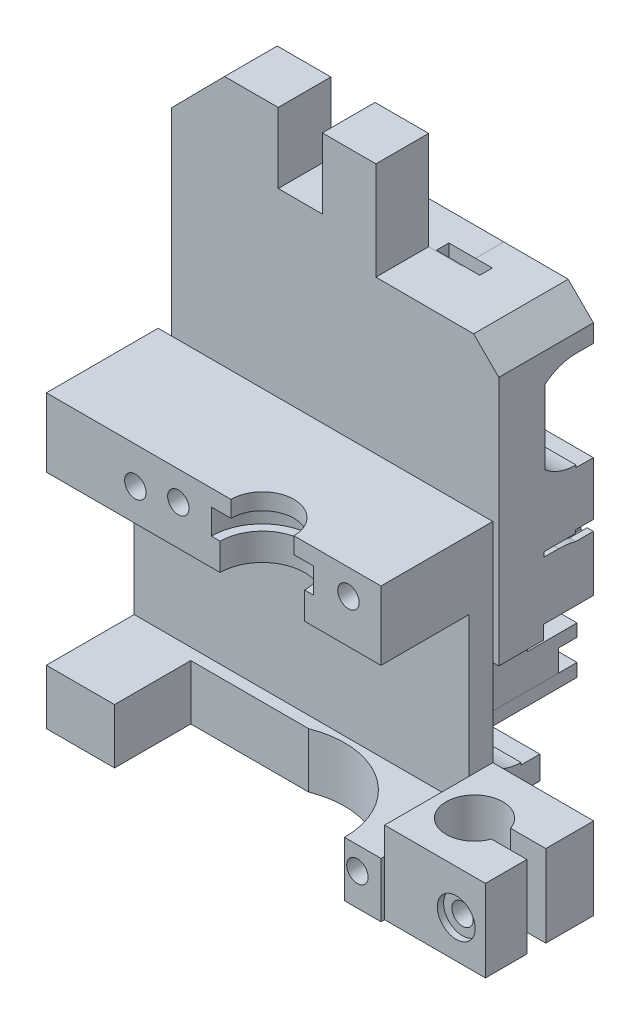
from build123d import *
from OCP.BRepAlgoAPI import BRepAlgoAPI_Cut
from OCP.TopTools import TopTools_ListOfShape

# Parameters (mm, degrees)
SKETCH1_W                     = 45
SKETCH1_H                     = 45
BOSS_EXTRUDE1_DEPTH           = 35
SKETCH2_R                     = 13
CUT_EXTRUDE3_DEPTH            = 35
SKETCH4_R                     = 1.7
CUT_EXTRUDE8_DEPTH            = 35
SKETCH7_R                     = 1.7
CUT_EXTRUDE9_DEPTH            = 35
SKETCH6_R                     = 1.7
CUT_EXTRUDE10_DEPTH           = 35
SKETCH5_R                     = 1.7
CUT_EXTRUDE11_DEPTH           = 35
CUT_EXTRUDE12_DEPTH           = 12
BOSS_EXTRUDE4_DEPTH           = 2
BOSS_EXTRUDE4_DEPTH_BACK      = 37.5
SKETCH14_W                    = 6
SKETCH14_H                    = 6
CUT_EXTRUDE17_START           = -7
SKETCH20_R                    = 2.2
CUT_EXTRUDE17_DEPTH           = 70.77141069
SKETCH21_R                    = 1.75
CUT_EXTRUDE18_DEPTH           = 2
BOSS_EXTRUDE5_DEPTH           = 44.571207257
BOSS_EXTRUDE5_DEPTH_BACK      = 1.562633388
SKETCH22_W                    = 53.082637552
SKETCH22_H                    = 40.002520942
SKETCH23_W                    = 29.449729346
SKETCH23_H                    = 26.517519529
CUT_EXTRUDE19_DEPTH           = 95.427299018
SKETCH25_R                    = 5
CUT_EXTRUDE24_DEPTH           = 2.6
SKETCH26_R                    = 8.1
CUT_EXTRUDE25_DEPTH           = 4
SKETCH27_R                    = 6.7
CUT_EXTRUDE28_DEPTH           = 6
SKETCH30_R                    = 13
CUT_EXTRUDE30_DEPTH           = 10.767560088
SKETCH31_W                    = 19.349450051
SKETCH31_H                    = 23.644133728
CUT_EXTRUDE31_DEPTH           = 9.664293754
SKETCH34_R                    = 1.5
CUT_EXTRUDE32_DEPTH           = 9
SKETCH37_W                    = 11.635024897
SKETCH37_H                    = 10.599921236
BOSS_EXTRUDE6_DEPTH           = 10
BOSS_EXTRUDE6_OTHER_WAY_DEPTH = 5
BOSS_EXTRUDE6_OTHER_WAY_TAPER = 29
SKETCH38_R                    = 1.700000001
CUT_EXTRUDE33_DEPTH           = 10
SKETCH39_R                    = 1.700000001
CUT_EXTRUDE34_DEPTH           = 88.0662855
SKETCH40_W                    = 17.159872711
SKETCH40_H                    = 13
BOSS_EXTRUDE7_DEPTH           = 16
SKETCH41_R                    = 4.5
CUT_EXTRUDE35_DEPTH           = 15
SKETCH42_W                    = 9.331425876
SKETCH42_H                    = 3
CUT_EXTRUDE36_DEPTH           = 15
CUT_EXTRUDE37_DEPTH           = 5
SKETCH44_R                    = 1.7
CUT_EXTRUDE38_DEPTH           = 23
CUT_EXTRUDE39_DEPTH           = 5
CUT_EXTRUDE40_DEPTH           = 5
CUT_EXTRUDE41_DEPTH           = 5
SKETCH53_R                    = 1.7
CUT_EXTRUDE42_DEPTH           = 90.646740997
SKETCH52_R                    = 1.7
CUT_EXTRUDE43_DEPTH           = 90.646740997
SKETCH51_R                    = 1.7
CUT_EXTRUDE44_DEPTH           = 90.646740997
CUT_EXTRUDE46_DEPTH           = 5
SKETCH57_R                    = 3
CUT_EXTRUDE48_DEPTH           = 2.5
SKETCH58_R                    = 3
CUT_EXTRUDE49_DEPTH           = 2.5
SKETCH59_R                    = 3
CUT_EXTRUDE50_DEPTH           = 2.5
SKETCH60_R                    = 3
CUT_EXTRUDE51_DEPTH           = 1
SKETCH61_W                    = 6.542017971
SKETCH61_H                    = 14.030300317
CUT_EXTRUDE52_DEPTH           = 6.5
SKETCH67_W                    = 5.604230097
SKETCH67_H                    = 8.996545788
BOSS_EXTRUDE8_DEPTH           = 33
SKETCH68_W                    = 5.604230097
SKETCH68_H                    = 9.400155495
BOSS_EXTRUDE9_DEPTH           = 33
SKETCH63_R                    = 1.7
CUT_EXTRUDE55_DEPTH           = 102.92049818
SKETCH62_R                    = 1.7
CUT_EXTRUDE56_DEPTH           = 102.92049818
SKETCH69_R                    = 3
CUT_EXTRUDE57_DEPTH           = 2.5
CUT_EXTRUDE58_DEPTH           = 2.5
SKETCH71_R                    = 3
CUT_EXTRUDE59_DEPTH           = 1
SKETCH73_R                    = 1.5
CUT_EXTRUDE61_DEPTH           = 5
SKETCH79_W                    = 95.658931194
SKETCH79_H                    = 51.290788201
CUT_EXTRUDE62_DEPTH           = 59
SKETCH80_W                    = 53.082637552
SKETCH80_H                    = 13.031868173
BOSS_EXTRUDE10_DEPTH          = 58
FILLET1_R                     = 5
SKETCH84_R                    = 17
CUT_EXTRUDE63_DEPTH           = 22
SKETCH85_R                    = 1.5
CUT_EXTRUDE64_DEPTH           = 15
SKETCH86_W                    = 15
SKETCH86_H                    = 8
BOSS_EXTRUDE11_DEPTH          = 7.5
BOSS_EXTRUDE12_START          = -29
BOSS_EXTRUDE12_DEPTH          = 15.917362448
BOSS_EXTRUDE12_START_2        = 15
BOSS_EXTRUDE12_2_OUTLINE_W    = 7.5
BOSS_EXTRUDE12_2_OUTLINE_H    = 8
BOSS_EXTRUDE12_2_DEPTH        = 10
BOSS_EXTRUDE13_DEPTH          = 15
BOSS_EXTRUDE13_START          = 15
BOSS_EXTRUDE13_2_DEPTH        = 10
SKETCH93_R                    = 7.627151398
CUT_EXTRUDE66_DEPTH           = 49.5
CUT_EXTRUDE67_DEPTH           = 53.5
SKETCH95_R                    = 7.676402713
CUT_EXTRUDE68_DEPTH           = 25.2
CUT_EXTRUDE69_DEPTH           = 34.5
CUT_EXTRUDE70_DEPTH           = 97.513539563
CUT_EXTRUDE70_DEPTH_BACK      = 97.513539563
SKETCH98_W                    = 8.013106882
SKETCH98_H                    = 5.054927498
SKETCH99_W                    = 2.898184018
SKETCH99_H                    = 3.4444183
CUT_EXTRUDE71_DEPTH           = 49.5
CUT_EXTRUDE75_DEPTH           = 2.8
CUT_EXTRUDE76_DEPTH           = 7.8
CUT_EXTRUDE77_START           = -2.8
CUT_EXTRUDE77_DEPTH           = 3.8
CUT_EXTRUDE77_START_2         = 24.96280414
CUT_EXTRUDE77_2_DEPTH         = 2.03719586
CUT_EXTRUDE78_DEPTH           = 7.8
SKETCH109_W                   = 3.474802874
SKETCH109_H                   = 1.768914447
SKETCH116_W                   = 11.383905976
SKETCH116_H                   = 17.385394655
CUT_EXTRUDE80_DEPTH           = 64
CUT_EXTRUDE81_DEPTH           = 1
SKETCH118_W                   = 155.245855906
SKETCH118_H                   = 137.927622152
CUT_EXTRUDE82_DEPTH           = 47


with BuildPart() as part:
    # Sketch1 → Boss-Extrude1 (new body)
    with BuildSketch(Plane.XY):
        Rectangle(SKETCH1_W, SKETCH1_H)
    extrude(amount=BOSS_EXTRUDE1_DEPTH)

    # Sketch2 → Cut-Extrude3 (cut)
    with BuildSketch(Plane.XY.offset(35)):
        Circle(SKETCH2_R)
    extrude(amount=-CUT_EXTRUDE3_DEPTH, mode=Mode.SUBTRACT)

    # Sketch4 → Cut-Extrude8 (cut)
    with BuildSketch(Plane(origin=(0, 0, 0), x_dir=(-1, 0, 0), z_dir=(0, 0, -1))):
        with Locations((-15.808862622, 15.928817575)):
            Circle(SKETCH4_R)
    extrude(amount=-CUT_EXTRUDE8_DEPTH, mode=Mode.SUBTRACT)

    # Sketch7 → Cut-Extrude9 (cut)
    with BuildSketch(Plane(origin=(0, 0, 0), x_dir=(-1, 0, 0), z_dir=(0, 0, -1))):
        with Locations((15.199970606, 15.923392722)):
            Circle(SKETCH7_R)
    extrude(amount=-CUT_EXTRUDE9_DEPTH, mode=Mode.SUBTRACT)

    # Sketch6 → Cut-Extrude10 (cut)
    with BuildSketch(Plane(origin=(0, 0, 0), x_dir=(-1, 0, 0), z_dir=(0, 0, -1))):
        with Locations((15.22029943, -15.065721832)):
            Circle(SKETCH6_R)
    extrude(amount=-CUT_EXTRUDE10_DEPTH, mode=Mode.SUBTRACT)

    # Sketch5 → Cut-Extrude11 (cut)
    with BuildSketch(Plane(origin=(0, 0, 0), x_dir=(-1, 0, 0), z_dir=(0, 0, -1))):
        with Locations((-15.781319068, -15.06525873)):
            Circle(SKETCH5_R)
    extrude(amount=-CUT_EXTRUDE11_DEPTH, mode=Mode.SUBTRACT)

    # Sketch8 → Cut-Extrude12 (cut)
    with BuildSketch(Plane(origin=(22.5, 0, 0), x_dir=(0, 0, -1), z_dir=(1, 0, 0))):
        Polygon((-4.363915061, -12.036124724), (-35, -12.036124724), (-35, 22.5), (-8.423058519, 22.5), (-8.423058519, 12.925541512), (-4.363915061, 12.925541512), align=None)
    extrude(amount=-CUT_EXTRUDE12_DEPTH, mode=Mode.SUBTRACT)

    # Sketch14 → Boss-Extrude4 (add, two sides: drawn at the far end of the back side and taken through both)
    with BuildSketch(Plane(origin=(0, 22.5, 0), x_dir=(1, 0, 0), z_dir=(0, 1, 0)).offset(-BOSS_EXTRUDE4_DEPTH_BACK)):
        with Locations((6.190916669, -17.729312446)):
            Rectangle(SKETCH14_W, SKETCH14_H)
    extrude(amount=BOSS_EXTRUDE4_DEPTH + BOSS_EXTRUDE4_DEPTH_BACK)

    # Sketch20 → Cut-Extrude17 (cut)
    with BuildSketch(Plane(origin=(0, 24.5, 0), x_dir=(1, 0, 0), z_dir=(0, 1, 0)).offset(CUT_EXTRUDE17_START)):
        with Locations(Location((6.190916669, -17.729312446, 0), (0, 0, 90))):
            Circle(SKETCH20_R)
    cut_extrude17 = extrude(amount=CUT_EXTRUDE17_DEPTH, mode=Mode.SUBTRACT)

    # Sketch21 → Cut-Extrude18 (cut)
    with BuildSketch(Plane(origin=(0, 17.5, 0), x_dir=(1, 0, 0), z_dir=(0, 1, 0))):
        with Locations(Location((6.190916669, -17.729312446, 0), (0, 0, 270))):
            Circle(SKETCH21_R)
    extrude(amount=-CUT_EXTRUDE18_DEPTH, mode=Mode.SUBTRACT)

    # Mirror6: Cut-Extrude17 across plane
    add(cut_extrude17.mirror(Plane.ZX.offset(16.5)), mode=Mode.SUBTRACT)

    # Sketch22 → Boss-Extrude5 (add, two sides: drawn at the far end of the back side and taken through both)
    with BuildSketch(Plane.XZ.offset(22.5).offset(-BOSS_EXTRUDE5_DEPTH_BACK)):
        with Locations((-1.541318776, 20.001258793)):
            Rectangle(SKETCH22_W, SKETCH22_H)
    extrude(amount=BOSS_EXTRUDE5_DEPTH + BOSS_EXTRUDE5_DEPTH_BACK)

    # Sketch23 → Cut-Extrude19 (cut, through all)
    with BuildSketch(Plane.ZY.offset(28.082637552)):
        with Locations((18.529138975, -45.100264067)):
            Rectangle(SKETCH23_W, SKETCH23_H)
    extrude(amount=-CUT_EXTRUDE19_DEPTH, mode=Mode.SUBTRACT)

    # Sketch25 → Cut-Extrude24 (cut)
    with BuildSketch(Plane(origin=(0, -20.937366612, 0), x_dir=(1, 0, 0), z_dir=(0, 1, 0))):
        with Locations(Location((6.190916669, -17.729312446, 0), (0, 0, 270))):
            Circle(SKETCH25_R)
    extrude(amount=-CUT_EXTRUDE24_DEPTH, mode=Mode.SUBTRACT)

    # Sketch26 → Cut-Extrude25 (cut)
    with BuildSketch(Plane(origin=(0, -23.537366612, 0), x_dir=(1, 0, 0), z_dir=(0, 1, 0))):
        with Locations(Location((6.190916669, -17.729312446, 0), (0, 0, 270))):
            Circle(SKETCH26_R)
    extrude(amount=-CUT_EXTRUDE25_DEPTH, mode=Mode.SUBTRACT)

    # Sketch27 → Cut-Extrude28 (cut)
    with BuildSketch(Plane(origin=(0, -27.537366612, 0), x_dir=(1, 0, 0), z_dir=(0, 1, 0))):
        with Locations(Location((6.190916669, -17.729312446, 0), (0, 0, 270))):
            Circle(SKETCH27_R)
    extrude(amount=-CUT_EXTRUDE28_DEPTH, mode=Mode.SUBTRACT)

    # Sketch30 → Cut-Extrude30 (cut)
    with BuildSketch(Plane(origin=(0, -58.359023831, 0), x_dir=(1, 0, 0), z_dir=(0, 1, 0))):
        with Locations(Location((6.207851035, -17.729312446, 0), (0, 0, 270))):
            Circle(SKETCH30_R)
    extrude(amount=-CUT_EXTRUDE30_DEPTH, mode=Mode.SUBTRACT)

    # Sketch31 → Cut-Extrude31 (cut)
    with BuildSketch(Plane.XZ.offset(67.071207257)):
        with Locations((-7.592166715, 17.462222744)):
            Rectangle(SKETCH31_W, SKETCH31_H)
    extrude(amount=-CUT_EXTRUDE31_DEPTH, mode=Mode.SUBTRACT)

    # Sketch34 → Cut-Extrude32 (cut)
    with BuildSketch(Plane.ZY.offset(28.082637552)):
        with Locations((35.530918006, -28.494957131)):
            Circle(SKETCH34_R)
        with Locations((3.530918006, -28.494957131)):
            Circle(SKETCH34_R)
        with Locations((35.530918006, -60.494957131)):
            Circle(SKETCH34_R)
        with Locations((3.530918006, -60.494957131)):
            Circle(SKETCH34_R)
    extrude(amount=-CUT_EXTRUDE32_DEPTH, mode=Mode.SUBTRACT)

    # Sketch37 → Boss-Extrude6 (add)
    with BuildSketch(Plane(origin=(25, 0, 0), x_dir=(0, 0, -1), z_dir=(1, 0, 0))):
        with Locations((-34.185004037, -63.658986353)):
            Rectangle(SKETCH37_W, SKETCH37_H)
    extrude(amount=BOSS_EXTRUDE6_DEPTH)

    # Sketch37 → Boss-Extrude6 other way (add)
    with BuildSketch(Plane(origin=(25, 0, 0), x_dir=(0, 0, -1), z_dir=(1, 0, 0))):
        with Locations((-34.185004037, -63.658986353)):
            Rectangle(SKETCH37_W, SKETCH37_H)
    extrude(amount=-BOSS_EXTRUDE6_OTHER_WAY_DEPTH, taper=BOSS_EXTRUDE6_OTHER_WAY_TAPER)

    # Sketch38 → Cut-Extrude33 (cut)
    with BuildSketch(Plane.XY.offset(40.002519264)):
        with Locations((29.034907303, -64.748396147)):
            Circle(SKETCH38_R)
    extrude(amount=-CUT_EXTRUDE33_DEPTH, mode=Mode.SUBTRACT)

    # Sketch39 → Cut-Extrude34 (cut, through all)
    with BuildSketch(Plane.XY.offset(40.002519264)):
        with Locations((-13.965092697, -26.748396147)):
            Circle(SKETCH39_R)
    extrude(amount=-CUT_EXTRUDE34_DEPTH, mode=Mode.SUBTRACT)

    # Sketch40 → Boss-Extrude7 (add)
    with BuildSketch(Plane(origin=(25, 0, 0), x_dir=(0, 0, -1), z_dir=(1, 0, 0))):
        with Locations((-8.579933523, -60.571207257)):
            Rectangle(SKETCH40_W, SKETCH40_H)
    extrude(amount=BOSS_EXTRUDE7_DEPTH)

    # Sketch41 → Cut-Extrude35 (cut)
    with BuildSketch(Plane(origin=(0, -54.071207257, 1.269334023), x_dir=(1, 0, 0), z_dir=(0, 1, 0))):
        with Locations(Location((31.163890056, -7.793414205, 0), (0, 0, 270))):
            Circle(SKETCH41_R)
    extrude(amount=-CUT_EXTRUDE35_DEPTH, mode=Mode.SUBTRACT)

    # Sketch42 → Cut-Extrude36 (cut)
    with BuildSketch(Plane(origin=(0, -54.071207257, 0), x_dir=(1, 0, 0), z_dir=(0, 1, 0))):
        with Locations((38.19390682, -9.095710432)):
            Rectangle(SKETCH42_W, SKETCH42_H)
    extrude(amount=-CUT_EXTRUDE36_DEPTH, mode=Mode.SUBTRACT)


with BuildPart() as cut_extrude37_tool:
    # Sketch43 → Cut-Extrude37 (new body)
    with BuildSketch(Plane(origin=(0, 0, 0), x_dir=(-1, 0, 0), z_dir=(0, 0, -1))):
        Polygon((-34.628927379, -64.403909926), (-32.738460245, -61.095415705), (-34.658466721, -57.80397603), (-38.468940333, -57.821030577), (-40.359407467, -61.129524799), (-38.439400991, -64.420964473), align=None)
    extrude(amount=-CUT_EXTRUDE37_DEPTH)


with BuildPart() as part_1:
    add(part.part)

    # Cut-Extrude37: cut by cut_extrude37_tool, with a tolerance
    cut_extrude37_stock = TopTools_ListOfShape()
    cut_extrude37_stock.Append(part_1.part.wrapped)
    cut_extrude37_tools = TopTools_ListOfShape()
    cut_extrude37_tools.Append(cut_extrude37_tool.part.wrapped)
    cut_extrude37_cut = BRepAlgoAPI_Cut()
    cut_extrude37_cut.SetArguments(cut_extrude37_stock)
    cut_extrude37_cut.SetTools(cut_extrude37_tools)
    cut_extrude37_cut.SetFuzzyValue(0.00001)
    cut_extrude37_cut.Build()
    add(Compound.cast(cut_extrude37_cut.Shape()).solids(), mode=Mode.REPLACE)

    # Sketch44 → Cut-Extrude38 (cut)
    with BuildSketch(Plane.XY.offset(17.159869878)):
        with Locations(Location((36.360549159, -61.087091915, 0), (0, 0, 123.670539257))):
            Circle(SKETCH44_R)
    extrude(amount=-CUT_EXTRUDE38_DEPTH, mode=Mode.SUBTRACT)


with BuildPart() as cut_extrude39_tool:
    # Sketch48 → Cut-Extrude39 (new body)
    with BuildSketch(Plane(origin=(0, 0, 0), x_dir=(-1, 0, 0), z_dir=(0, 0, -1))):
        Polygon((9.066729233, -28.811078933), (10.957196368, -25.502584711), (9.037189891, -22.211145037), (5.22671628, -22.228199584), (3.336249145, -25.536693806), (5.256255622, -28.82813348), align=None)
    extrude(amount=-CUT_EXTRUDE39_DEPTH)


with BuildPart() as part_2:
    add(part_1.part)

    # Cut-Extrude39: cut by cut_extrude39_tool, with a tolerance
    cut_extrude39_stock = TopTools_ListOfShape()
    cut_extrude39_stock.Append(part_2.part.wrapped)
    cut_extrude39_tools = TopTools_ListOfShape()
    cut_extrude39_tools.Append(cut_extrude39_tool.part.wrapped)
    cut_extrude39_cut = BRepAlgoAPI_Cut()
    cut_extrude39_cut.SetArguments(cut_extrude39_stock)
    cut_extrude39_cut.SetTools(cut_extrude39_tools)
    cut_extrude39_cut.SetFuzzyValue(0.00001)
    cut_extrude39_cut.Build()
    add(Compound.cast(cut_extrude39_cut.Shape()).solids(), mode=Mode.REPLACE)


with BuildPart() as cut_extrude40_tool:
    # Sketch49 → Cut-Extrude40 (new body)
    with BuildSketch(Plane(origin=(0, 0, 0), x_dir=(-1, 0, 0), z_dir=(0, 0, -1))):
        Polygon((-19.339505263, -65.26594849), (-17.449038128, -61.957454268), (-19.369044605, -58.666014594), (-23.179518216, -58.683069141), (-25.06998535, -61.991563363), (-23.149978874, -65.283003037), align=None)
    extrude(amount=-CUT_EXTRUDE40_DEPTH)


with BuildPart() as part_3:
    add(part_2.part)

    # Cut-Extrude40: cut by cut_extrude40_tool, with a tolerance
    cut_extrude40_stock = TopTools_ListOfShape()
    cut_extrude40_stock.Append(part_3.part.wrapped)
    cut_extrude40_tools = TopTools_ListOfShape()
    cut_extrude40_tools.Append(cut_extrude40_tool.part.wrapped)
    cut_extrude40_cut = BRepAlgoAPI_Cut()
    cut_extrude40_cut.SetArguments(cut_extrude40_stock)
    cut_extrude40_cut.SetTools(cut_extrude40_tools)
    cut_extrude40_cut.SetFuzzyValue(0.00001)
    cut_extrude40_cut.Build()
    add(Compound.cast(cut_extrude40_cut.Shape()).solids(), mode=Mode.REPLACE)


with BuildPart() as cut_extrude41_tool:
    # Sketch50 → Cut-Extrude41 (new body)
    with BuildSketch(Plane(origin=(0, 0, 0), x_dir=(-1, 0, 0), z_dir=(0, 0, -1))):
        Polygon((-17.911640095, -28.243498116), (-16.02117296, -24.935003895), (-17.941179437, -21.64356422), (-21.751653048, -21.660618767), (-23.642120183, -24.969112989), (-21.722113706, -28.260552663), align=None)
    extrude(amount=-CUT_EXTRUDE41_DEPTH)


with BuildPart() as part_4:
    add(part_3.part)

    # Cut-Extrude41: cut by cut_extrude41_tool, with a tolerance
    cut_extrude41_stock = TopTools_ListOfShape()
    cut_extrude41_stock.Append(part_4.part.wrapped)
    cut_extrude41_tools = TopTools_ListOfShape()
    cut_extrude41_tools.Append(cut_extrude41_tool.part.wrapped)
    cut_extrude41_cut = BRepAlgoAPI_Cut()
    cut_extrude41_cut.SetArguments(cut_extrude41_stock)
    cut_extrude41_cut.SetTools(cut_extrude41_tools)
    cut_extrude41_cut.SetFuzzyValue(0.00001)
    cut_extrude41_cut.Build()
    add(Compound.cast(cut_extrude41_cut.Shape()).solids(), mode=Mode.REPLACE)

    # Sketch53 → Cut-Extrude42 (cut, through all)
    with BuildSketch(Plane.XY.offset(40.002519264)):
        with Locations((21.259511739, -61.974508816)):
            Circle(SKETCH53_R)
    extrude(amount=-CUT_EXTRUDE42_DEPTH, mode=Mode.SUBTRACT)

    # Sketch52 → Cut-Extrude43 (cut, through all)
    with BuildSketch(Plane.XY.offset(40.002519264)):
        with Locations((19.831646572, -24.952058442)):
            Circle(SKETCH52_R)
    extrude(amount=-CUT_EXTRUDE43_DEPTH, mode=Mode.SUBTRACT)

    # Sketch51 → Cut-Extrude44 (cut, through all)
    with BuildSketch(Plane.XY.offset(40.002519264)):
        with Locations((-7.146722757, -25.519639258)):
            Circle(SKETCH51_R)
    extrude(amount=-CUT_EXTRUDE44_DEPTH, mode=Mode.SUBTRACT)


with BuildPart() as cut_extrude46_tool:
    # Sketch55 → Cut-Extrude46 (new body)
    with BuildSketch(Plane(origin=(0, 0, 0), x_dir=(-1, 0, 0), z_dir=(0, 0, -1))):
        Polygon((16.745274795, -30.164507999), (18.313623392, -26.048743749), (15.533441294, -22.632631898), (11.1849106, -23.332284296), (9.616562003, -27.448048545), (12.396744101, -30.864160397), align=None)
    extrude(amount=-CUT_EXTRUDE46_DEPTH)


with BuildPart() as part_5:
    add(part_4.part)

    # Cut-Extrude46: cut by cut_extrude46_tool, with a tolerance
    cut_extrude46_stock = TopTools_ListOfShape()
    cut_extrude46_stock.Append(part_5.part.wrapped)
    cut_extrude46_tools = TopTools_ListOfShape()
    cut_extrude46_tools.Append(cut_extrude46_tool.part.wrapped)
    cut_extrude46_cut = BRepAlgoAPI_Cut()
    cut_extrude46_cut.SetArguments(cut_extrude46_stock)
    cut_extrude46_cut.SetTools(cut_extrude46_tools)
    cut_extrude46_cut.SetFuzzyValue(0.00001)
    cut_extrude46_cut.Build()
    add(Compound.cast(cut_extrude46_cut.Shape()).solids(), mode=Mode.REPLACE)

    # Sketch57 → Cut-Extrude48 (cut)
    with BuildSketch(Plane.XY.offset(40.002519264)):
        with Locations((-7.146722757, -25.519639258)):
            Circle(SKETCH57_R)
    extrude(amount=-CUT_EXTRUDE48_DEPTH, mode=Mode.SUBTRACT)

    # Sketch58 → Cut-Extrude49 (cut)
    with BuildSketch(Plane.XY.offset(40.002519264)):
        with Locations((19.831646572, -24.952058442)):
            Circle(SKETCH58_R)
    extrude(amount=-CUT_EXTRUDE49_DEPTH, mode=Mode.SUBTRACT)

    # Sketch59 → Cut-Extrude50 (cut)
    with BuildSketch(Plane.XY.offset(40.002519264)):
        with Locations((21.259511739, -61.974508816)):
            Circle(SKETCH59_R)
    extrude(amount=-CUT_EXTRUDE50_DEPTH, mode=Mode.SUBTRACT)

    # Sketch60 → Cut-Extrude51 (cut)
    with BuildSketch(Plane(origin=(0, 0, 0), x_dir=(-1, 0, 0), z_dir=(0, 0, -1))):
        with Locations((-15.808862622, 15.928817575)):
            Circle(SKETCH60_R)
        with Locations((15.199970606, 15.923392722)):
            Circle(SKETCH60_R)
        with Locations((-15.781319068, -15.06525873)):
            Circle(SKETCH60_R)
        with Locations((15.22029943, -15.065721832)):
            Circle(SKETCH60_R)
    extrude(amount=-CUT_EXTRUDE51_DEPTH, mode=Mode.SUBTRACT)

    # Sketch61 → Cut-Extrude52 (cut)
    with BuildSketch(Plane(origin=(9.190916669, 0, 0), x_dir=(0, 0, -1), z_dir=(1, 0, 0))):
        with Locations((-17.812553374, 0.202623489)):
            Rectangle(SKETCH61_W, SKETCH61_H)
    extrude(amount=-CUT_EXTRUDE52_DEPTH, mode=Mode.SUBTRACT)

    # Sketch67 → Boss-Extrude8 (add)
    with BuildSketch(Plane(origin=(-22.5, -2.468350024, 0), x_dir=(0, 0, 1), z_dir=(-1, 0, 0))):
        with Locations((29.51622543, -5.940778019)):
            Rectangle(SKETCH67_W, SKETCH67_H)
    extrude(amount=-BOSS_EXTRUDE8_DEPTH)

    # Sketch68 → Boss-Extrude9 (add)
    with BuildSketch(Plane(origin=(-22.5, -2.468350024, 0), x_dir=(0, 0, 1), z_dir=(-1, 0, 0))):
        with Locations((9.47264346, -5.966332429)):
            Rectangle(SKETCH68_W, SKETCH68_H)
    extrude(amount=-BOSS_EXTRUDE9_DEPTH)

    # Sketch63 → Cut-Extrude55 (cut, through all)
    with BuildSketch(Plane.ZY.offset(22.5)):
        with Locations(Location((29.516225429, -7.068802512, 0), (0, 0, 270))):
            Circle(SKETCH63_R)
    extrude(amount=-CUT_EXTRUDE55_DEPTH, mode=Mode.SUBTRACT)

    # Sketch62 → Cut-Extrude56 (cut, through all)
    with BuildSketch(Plane.ZY.offset(22.5)):
        with Locations(Location((9.403782955, -7.127149089, 0), (0, 0, 270))):
            Circle(SKETCH62_R)
    extrude(amount=-CUT_EXTRUDE56_DEPTH, mode=Mode.SUBTRACT)

    # Sketch69 → Cut-Extrude57 (cut)
    with BuildSketch(Plane.ZY.offset(22.5)):
        with Locations(Location((9.403782955, -7.127149089, 0), (0, 0, 270))):
            Circle(SKETCH69_R)
        with Locations(Location((29.516225429, -7.068802512, 0), (0, 0, 270))):
            Circle(SKETCH69_R)
    extrude(amount=-CUT_EXTRUDE57_DEPTH, mode=Mode.SUBTRACT)

    # Sketch70 → Cut-Extrude58 (cut)
    with BuildSketch(Plane(origin=(0, 0, 28.367491588), x_dir=(-1, 0, 0), z_dir=(0, 0, -1))):
        Polygon((-25.057295961, -66.811454801), (-25.259440428, -62.335213005), (-29.23705177, -60.272154352), (-33.012518645, -62.685337494), (-32.810374177, -67.161579289), (-28.832762835, -69.224637943), align=None)
    extrude(amount=-CUT_EXTRUDE58_DEPTH, mode=Mode.SUBTRACT)

    # Sketch71 → Cut-Extrude59 (cut)
    with BuildSketch(Plane.XY.offset(17.159869878)):
        with Locations((36.360549159, -61.087091915)):
            Circle(SKETCH71_R)
    extrude(amount=-CUT_EXTRUDE59_DEPTH, mode=Mode.SUBTRACT)

    # Sketch73 → Cut-Extrude61 (cut)
    with BuildSketch(Plane.XY.offset(40.002519264)):
        with Locations((-24.369276222, -64.32278971)):
            Circle(SKETCH73_R)
    extrude(amount=-CUT_EXTRUDE61_DEPTH, mode=Mode.SUBTRACT)

    # Sketch79 → Cut-Extrude62 (cut)
    with BuildSketch(Plane(origin=(0, -20.937366612, 0), x_dir=(1, 0, 0), z_dir=(0, 1, 0))):
        with Locations((-4.270574665, -23.740541644)):
            Rectangle(SKETCH79_W, SKETCH79_H)
    extrude(amount=CUT_EXTRUDE62_DEPTH, mode=Mode.SUBTRACT)

    # Sketch80 → Boss-Extrude10 (add)
    with BuildSketch(Plane(origin=(0, -20.937366612, 0), x_dir=(1, 0, 0), z_dir=(0, 1, 0))):
        with Locations((-1.541318776, -33.486585178)):
            Rectangle(SKETCH80_W, SKETCH80_H)
    extrude(amount=BOSS_EXTRUDE10_DEPTH)

    # Fillet1
    fillet1_edges = [part_5.edges().sort_by_distance(p)[0] for p in [
        (-28.082637552, 37.062633388, 33.486585177),
        (25, 37.062633388, 33.486585177),
    ]]
    fillet(fillet1_edges, radius=FILLET1_R)

    # Sketch84 → Cut-Extrude63 (cut)
    with BuildSketch(Plane(origin=(0, 0, 26.970651091), x_dir=(-1, 0, 0), z_dir=(0, 0, -1))):
        with Locations((-0.29898878, 13.603645853)):
            Circle(SKETCH84_R)
    extrude(amount=-CUT_EXTRUDE63_DEPTH, mode=Mode.SUBTRACT)

    # Sketch85 → Cut-Extrude64 (cut)
    with BuildSketch(Plane.XY.offset(40.002519264)):
        with Locations((15.736832887, 29.13557467)):
            Circle(SKETCH85_R)
        with Locations((15.736832887, -1.86442533)):
            Circle(SKETCH85_R)
        with Locations((-15.263167113, -1.86442533)):
            Circle(SKETCH85_R)
        with Locations((-15.263167113, 29.13557467)):
            Circle(SKETCH85_R)
    extrude(amount=-CUT_EXTRUDE64_DEPTH, mode=Mode.SUBTRACT)

    # Sketch86 → Boss-Extrude11 (add)
    with BuildSketch(Plane(origin=(0, -20.937366612, 0), x_dir=(1, 0, 0), z_dir=(0, 1, 0))):
        with Locations((-20.582637552, -22.970651091)):
            Rectangle(SKETCH86_W, SKETCH86_H)
    extrude(amount=BOSS_EXTRUDE11_DEPTH)

    # Boss-Extrude12: read off the stored shape, not the designer's step
    # Boss-Extrude12 outline → Boss-Extrude12 (cut)
    with BuildSketch(Plane.YZ.offset(BOSS_EXTRUDE12_START)):
        with BuildLine():
            Line((-16.437366612, 18.970651091), (-13.437366612, 18.970651091))
            Line((-13.437366612, 18.970651091), (-13.437366612, 21.970651091))
            ThreePointArc((-13.437366612, 21.970651091), (-14.316046269, 19.849330747), (-16.437366612, 18.970651091))
        make_face()
    extrude(amount=BOSS_EXTRUDE12_DEPTH, mode=Mode.SUBTRACT)

    # Boss-Extrude12 2 outline → Boss-Extrude12 2 (add)
    with BuildSketch(Plane.YZ.offset(BOSS_EXTRUDE12_START_2)):
        with Locations((-17.187366612, 22.970651091)):
            Rectangle(BOSS_EXTRUDE12_2_OUTLINE_W, BOSS_EXTRUDE12_2_OUTLINE_H)
    extrude(amount=BOSS_EXTRUDE12_2_DEPTH)

    # Boss-Extrude13: read off the stored shape, not the designer's step
    # Boss-Extrude13 outline → Boss-Extrude13 (add)
    with BuildSketch(Plane(origin=(0, 0, 0), x_dir=(-1, 0, 0), z_dir=(0, 0, -1))):
        Polygon((-23.36274568, -48.619339256), (-23.367757646, -50.680300201), (-17.462746069, -50.680300201), (-17.462746069, -67.863551646), (-14.177545807, -71.190127808), (14.249697088, -71.190127808), (17.037255803, -68.36197067), (17.037255803, -50.689145022), (26.017272956, -50.689145022), (26.017272956, -40.681920979), (25.993659225, -36.474000388), (25.993659225, 10.373411619), (17.549011758, 18.922680584), (9.039575962, 18.922680584), (9.039575962, 7.780578291), (2.010790556, 7.780578291), (2.041381355, 18.922680584), (-6.46274534, 18.922680584), (-6.46274534, 3.355731571), (-21.962746009, 3.324374492), (-25.955095041, -0.667921289), (-25.955095041, -40.308078249), (-23.36274568, -40.308078249), align=None)
    extrude(amount=BOSS_EXTRUDE13_DEPTH)

    # Boss-Extrude13 2 outline → Boss-Extrude13 2 (cut)
    with BuildSketch(Plane.YZ.offset(BOSS_EXTRUDE13_START)):
        with BuildLine():
            Line((-13.437366612, 18.970651091), (-13.437366612, 22.970651091))
            ThreePointArc((-13.437366612, 22.970651091), (-14.608939488, 20.142223966), (-17.437366612, 18.970651091))
            Line((-17.437366612, 18.970651091), (-13.437366612, 18.970651091))
        make_face()
    extrude(amount=BOSS_EXTRUDE13_2_DEPTH, mode=Mode.SUBTRACT)

    # Sketch93 → Cut-Extrude66 (cut)
    with BuildSketch(Plane(origin=(24.955095041, 0, 0), x_dir=(0, 0, -1), z_dir=(1, 0, 0))):
        with Locations((12.256212071, -11.171428731)):
            Circle(SKETCH93_R)
    extrude(amount=-CUT_EXTRUDE66_DEPTH, mode=Mode.SUBTRACT)

    # Sketch94 → Cut-Extrude67 (cut)
    with BuildSketch(Plane(origin=(25.955095041, 0, 0), x_dir=(0, 0, -1), z_dir=(1, 0, 0))):
        with BuildLine():
            Line((7.304469319, -5.317971055), (7.304469319, -17.0155586))
            ThreePointArc((7.304469319, -17.0155586), (9.618622803, -18.361450318), (12.254533613, -18.82910945))
            Line((12.254533613, -18.82910945), (12.247539174, -19.175326281))
            Line((12.247539174, -19.175326281), (15.247498718, -19.190821279))
            Line((15.247498718, -19.190821279), (15.247498718, -18.220394035))
            ThreePointArc((15.247498718, -18.220394035), (19.890575189, -11.801110292), (16.37036652, -4.703681616))
            Line((16.37036652, -4.703681616), (16.37036652, -3.504420205))
            Line((16.37036652, -3.504420205), (12.254533613, -3.504420205))
            ThreePointArc((12.254533613, -3.504420205), (9.618622803, -3.972079337), (7.304469319, -5.317971055))
        make_face()
    extrude(amount=-CUT_EXTRUDE67_DEPTH, mode=Mode.SUBTRACT)

    # Sketch95 → Cut-Extrude68 (cut)
    with BuildSketch(Plane(origin=(12.462746069, 0, 0), x_dir=(0, 0, -1), z_dir=(1, 0, 0))):
        with Locations((12.092444965, -56.175071744)):
            Circle(SKETCH95_R)
    extrude(amount=-CUT_EXTRUDE68_DEPTH, mode=Mode.SUBTRACT)


with BuildPart() as cut_extrude69_tool:
    # Sketch96 → Cut-Extrude69 (new body)
    with BuildSketch(Plane(origin=(17.462746069, 0, 0), x_dir=(0, 0, -1), z_dir=(1, 0, 0))):
        with BuildLine():
            Line((7.026567917, -61.944543955), (7.093866549, -50.680300201))
            Line((7.093866549, -50.680300201), (18.039621023, -50.680300201))
            ThreePointArc((18.039621023, -50.680300201), (19.821216346, -57.783077051), (15, -63.294827572))
            Line((15, -63.294827572), (15, -64.164154351))
            Line((15, -64.164154351), (12.017415984, -64.164154351))
            Line((12.017415984, -64.164154351), (12.017415984, -63.827835882))
            ThreePointArc((12.017415984, -63.827835882), (9.358123262, -63.320452774), (7.026567917, -61.944543955))
        make_face()
    extrude(amount=-CUT_EXTRUDE69_DEPTH)


with BuildPart() as part_6:
    add(part_5.part)

    # Cut-Extrude69: cut by cut_extrude69_tool, with a tolerance
    cut_extrude69_stock = TopTools_ListOfShape()
    cut_extrude69_stock.Append(part_6.part.wrapped)
    cut_extrude69_tools = TopTools_ListOfShape()
    cut_extrude69_tools.Append(cut_extrude69_tool.part.wrapped)
    cut_extrude69_cut = BRepAlgoAPI_Cut()
    cut_extrude69_cut.SetArguments(cut_extrude69_stock)
    cut_extrude69_cut.SetTools(cut_extrude69_tools)
    cut_extrude69_cut.SetFuzzyValue(0.00001)
    cut_extrude69_cut.Build()
    add(Compound.cast(cut_extrude69_cut.Shape()).solids(), mode=Mode.REPLACE)

    # Sketch98 → Cut-Extrude70 (cut, two sides: drawn at the far end of the back side and taken through both)
    with BuildSketch(Plane(origin=(23.36274568, 0, 0), x_dir=(0, 0, -1), z_dir=(1, 0, 0)).offset(-CUT_EXTRUDE70_DEPTH_BACK)):
        with Locations((11.116985965, -40.66303761)):
            Rectangle(SKETCH98_W, SKETCH98_H)
    extrude(amount=CUT_EXTRUDE70_DEPTH + CUT_EXTRUDE70_DEPTH_BACK, mode=Mode.SUBTRACT)

    # Sketch99 → Cut-Extrude71 (cut)
    with BuildSketch(Plane(origin=(23.36274568, 0, 0), x_dir=(0, 0, -1), z_dir=(1, 0, 0))):
        with Locations((13.550907991, -46.897130106)):
            Rectangle(SKETCH99_W, SKETCH99_H)
    extrude(amount=-CUT_EXTRUDE71_DEPTH, mode=Mode.SUBTRACT)

    # Sketch104 → Cut-Extrude75 (cut)
    with BuildSketch(Plane(origin=(0, 0, -15), x_dir=(-1, 0, 0), z_dir=(0, 0, -1))):
        Polygon((-25.962747095, -29.314686028), (-24.96280414, -29.314686028), (-24.962745068, -30.066577416), (-23.962746767, -30.066577416), (-23.962555313, -29.299441116), (-22.961420056, -29.299441116), (-22.962748465, -30.066577416), (-21.962746439, -30.066577416), (-21.962746439, -29.314686028), (-20.962748138, -29.314686028), (-20.962748138, -30.066577416), (-19.962746111, -30.066577416), (-19.962746111, -29.299986228), (-19.144147096, -28.918292488), (-18.826346306, -29.599683698), (-17.920043275, -29.177095608), (-18.237847297, -28.495596886), (-17.33154498, -28.073009129), (-17.013747421, -28.754493991), (-16.107448591, -28.33179631), (-16.425247698, -27.650408709), (-15.518847316, -27.227813689), (-15.201147108, -27.9092049), (-14.294844791, -27.486617142), (-14.552147522, -26.934719209), (-13.762747332, -26.934719209), (-13.762747332, -27.686608735), (-12.762747168, -27.686608735), (-12.758801937, -26.913738568), (-11.762747004, -26.934719209), (-11.762747004, -27.686608735), (-10.76274684, -27.686608735), (-10.76274684, -26.934719209), (-9.762746677, -26.934719209), (-9.762746677, -27.686608735), (-8.762746512, -27.686608735), (-8.762746512, -26.934719209), (-7.762746349, -26.934719209), (-7.762746349, -27.686608735), (-6.854745954, -27.686608735), (-6.836747215, -25.281740545), (-6.838062023, -25.283268804), (-15.295775537, -25.339216406), (-20.3314935, -27.686608735), (-25.955095041, -27.686608735), align=None)
    extrude(amount=-CUT_EXTRUDE75_DEPTH, mode=Mode.SUBTRACT)

    # Sketch100 → Cut-Extrude76 (cut)
    with BuildSketch(Plane(origin=(0, 0, -15), x_dir=(-1, 0, 0), z_dir=(0, 0, -1))):
        Polygon((-25.955095041, -28.945247979), (-24.96280414, -28.945247979), (-24.96280414, -29.653634253), (-23.962555313, -29.653634253), (-23.962555313, -28.945247979), (-22.96424876, -28.945247979), (-22.958591351, -29.653634253), (-21.96304054, -29.653634253), (-21.96304054, -28.945247979), (-20.964934987, -28.945247979), (-20.959285676, -29.652620306), (-19.966016734, -29.644687729), (-19.972347716, -28.851960783), (-19.311248099, -28.543611164), (-19.008595517, -29.192496369), (-18.101434673, -28.769379045), (-18.404087256, -28.120493839), (-17.504286227, -27.700809274), (-17.201633644, -28.34969448), (-16.290191613, -27.924580327), (-16.592844196, -27.275695121), (-15.694477438, -26.856679528), (-15.219820827, -27.874340274), (-14.310167076, -27.450060209), (-14.728288096, -26.553611409), (-13.753525037, -26.553611409), (-13.753525037, -27.273865726), (-12.758801937, -27.273865726), (-12.758801937, -26.553611409), (-11.754470509, -26.553611409), (-11.754470509, -27.273865726), (-10.75686259, -27.273865726), (-10.75686259, -26.553611409), (-9.753121992, -26.553611409), (-9.753121992, -27.273865726), (-8.756088304, -27.273865726), (-8.756088304, -26.553611409), (-7.751750339, -26.553611409), (-7.751750339, -27.273865726), (-7.458768632, -27.273865726), (-6.712940952, -27.776466421), (-6.455012931, -27.900295376), (-6.808295478, -25.767524786), (-15.079976742, -25.767524786), (-20.197235679, -28.15997504), (-25.955095041, -28.199343388), align=None)
    extrude(amount=-CUT_EXTRUDE76_DEPTH, mode=Mode.SUBTRACT)

    # Cut-Extrude77: read off the stored shape, not the designer's step
    # Cut-Extrude77 outline → Cut-Extrude77 (cut)
    with BuildSketch(Plane(origin=(0, 0, -15), x_dir=(-1, 0, 0), z_dir=(0, 0, -1)).offset(CUT_EXTRUDE77_START)):
        Polygon((25.037253816, -32.066549204), (25.037253816, -31.307907657), (25.993659225, -31.314365331), (25.993659225, -30.182050347), (20.166533002, -30.182050347), (11.585187457, -25.26675256), (8.223678341, -25.225537355), (7.936525965, -27.116615257), (8.687253647, -27.116615257), (8.687253647, -26.364725731), (9.687253345, -26.364725731), (9.687253345, -27.116615257), (10.687253509, -27.116615257), (10.687253509, -26.364725731), (11.300593219, -26.364725731), (11.504443433, -26.482424708), (11.128503435, -27.133516674), (11.994533312, -27.633509155), (12.370473311, -26.98241719), (13.23649666, -27.482405902), (12.860554217, -28.133502102), (13.726584095, -28.633494583), (14.102523287, -27.982404015), (14.968546637, -28.482392727), (14.592604194, -29.133488927), (15.458634159, -29.633481459), (15.83457287, -28.982391722), (16.70059837, -29.482381676), (16.324657404, -30.133475318), (17.190685132, -30.633466558), (17.566623356, -29.982377665), (18.432646619, -30.482366327), (18.05670665, -31.133458242), (18.922736702, -31.633450824), (19.298673448, -30.98236449), (20.037253462, -31.408759256), (20.037253462, -32.066549204), (21.03725316, -32.066549204), (21.03725316, -31.314659678), (22.037253324, -31.314659678), (22.037253324, -32.066549204), (23.037253488, -32.066549204), (23.037253488, -31.314659678), (24.037253186, -31.314659678), (24.037253186, -32.066549204), align=None)
    extrude(amount=CUT_EXTRUDE77_DEPTH, mode=Mode.SUBTRACT)

    # Cut-Extrude77 2 outline → Cut-Extrude77 2 (cut)
    with BuildSketch(Plane.YZ.offset(CUT_EXTRUDE77_START_2)):
        with BuildLine():
            Line((-28.945247979, -12.2), (-28.945247979, -9.506994896))
            ThreePointArc((-28.945247979, -9.506994896), (-29.038037991, -10.866108666), (-29.314686028, -12.2))
            Line((-29.314686028, -12.2), (-28.945247979, -12.2))
        make_face()
    extrude(amount=CUT_EXTRUDE77_2_DEPTH, mode=Mode.SUBTRACT)

    # Sketch108 → Cut-Extrude78 (cut)
    with BuildSketch(Plane(origin=(0, 0, -15), x_dir=(-1, 0, 0), z_dir=(0, 0, -1))):
        Polygon((8.226439423, -26.699867267), (8.658716653, -26.732210962), (8.658716653, -25.962704734), (9.664352311, -25.962704734), (9.687253345, -26.699401718), (10.687253509, -26.699401718), (10.687253509, -25.962704734), (11.404382143, -25.962704734), (11.706675461, -26.117537897), (11.360435825, -26.793529567), (12.182503311, -27.307963172), (12.558809802, -26.656236477), (13.409910595, -27.147661418), (13.048525439, -27.807954002), (13.914553691, -28.307949299), (14.302417941, -27.636140183), (15.163884185, -28.133501637), (14.780573386, -28.80794341), (15.64658102, -29.307975549), (16.037904671, -28.630240574), (16.903451672, -29.130006745), (16.512627887, -29.807928497), (17.336177211, -30.282706984), (17.751550635, -29.618938167), (18.625090615, -30.122536407), (18.256107931, -30.773265697), (19.110665426, -31.266638434), (19.484994425, -30.618273358), (20.046502181, -30.942455896), (20.044424464, -31.649335664), (21.03725316, -31.649335664), (21.03725316, -30.896614279), (22.038752496, -30.896614279), (22.037253324, -31.649335664), (23.037253488, -31.649335664), (23.037253488, -30.896614279), (24.031061878, -30.896614279), (24.037253186, -31.649335664), (25.037253816, -31.649335664), (25.037253816, -30.896614279), (26.037253887, -30.912138111), (25.993659225, -29.661682877), (20.084292403, -29.661682877), (11.510643246, -24.711747068), (7.735310008, -24.675249023), align=None)
    extrude(amount=-CUT_EXTRUDE78_DEPTH, mode=Mode.SUBTRACT)

    # Cut-Sweep2: sweep along a path in Sketch111
    with BuildLine(Plane.ZY.offset(20.993659225)) as cut_sweep2_path:
        CenterArc((-11.50693286, -11.111866598), 9.973751919, 0, 360)
    # Sketch109 → Cut-Sweep2 (sweep, cut)
    with BuildSketch(Plane(origin=(0, 0, -15), x_dir=(-1, 0, 0), z_dir=(0, 0, -1))):
        with Locations((21.04243553, -1.343740229)):
            Rectangle(SKETCH109_W, SKETCH109_H)
    sweep(path=cut_sweep2_path.line, mode=Mode.SUBTRACT)

    # Cut-Extrude79: read off the stored shape, not the designer's step
    # Cut-Extrude79: loft between two sections, ruled curve by curve
    cut_extrude79_from = [
        Edge.make_three_point_arc((17.180563719, -2.228855966, -15), (17.180563719, -4.180492922, -7.501667083), (17.180563719, -11.194855704, -4.210375833)),
        Edge.make_three_point_arc((17.180563719, -11.194855704, -4.210375833), (17.180563719, -18.209218487, -7.501667083), (17.180563719, -20.160855443, -15)),
        Edge.make_three_point_arc((17.180563719, -0.421929492, -15), (17.180563719, -2.917070683, -6.236722824), (17.180563719, -11.194855704, -2.428963436)),
        Edge.make_three_point_arc((17.180563719, -11.194855704, -2.428963436), (17.180563719, -19.472640726, -6.236722824), (17.180563719, -21.967781917, -15)),
        Edge.make_line((17.180563719, -0.421929492, -15), (17.180563719, -2.228855966, -15)),
        Edge.make_line((17.180563719, -21.967781917, -15), (17.180563719, -20.160855443, -15)),
    ]
    cut_extrude79_to = [
        Edge.make_three_point_arc((20.73735583, -2.228855966, -15), (20.73735583, -4.180492922, -7.501667083), (20.73735583, -11.194855704, -4.210375833)),
        Edge.make_three_point_arc((20.73735583, -11.194855704, -4.210375833), (20.73735583, -18.209218487, -7.501667083), (20.73735583, -20.160855443, -15)),
        Edge.make_three_point_arc((20.73735583, -0.421929492, -15), (20.73735583, -2.917070683, -6.236722824), (20.73735583, -11.194855704, -2.428963436)),
        Edge.make_three_point_arc((20.73735583, -11.194855704, -2.428963436), (20.73735583, -19.472640726, -6.236722824), (20.73735583, -21.967781917, -15)),
        Edge.make_line((20.73735583, -0.421929492, -15), (20.73735583, -2.228855966, -15)),
        Edge.make_line((20.73735583, -21.967781917, -15), (20.73735583, -20.160855443, -15)),
    ]
    cut_extrude79 = Solid(Shell([*[Face.make_surface_from_curves(cut_extrude79_from[k], cut_extrude79_to[k]) for k in range(6)], Face(Wire(cut_extrude79_from)), Face(Wire(cut_extrude79_to))]))
    add(cut_extrude79, mode=Mode.SUBTRACT)

    # Cut-Extrude79 2: loft between two sections, ruled curve by curve
    cut_extrude79_2_from = [
        Edge.make_line((7.544895519, -0.163078289, -10.5), (7.544895519, 3.353542341, -10.5)),
        Edge.make_line((14.418603844, 3.339636573, -10.5), (14.418603844, -0.163078289, -10.5)),
        Edge.make_line((9.2633226, -3.139481303, -10.5), (7.544895519, -0.163078289, -10.5)),
        Edge.make_line((12.700176763, -3.139481303, -10.5), (9.2633226, -3.139481303, -10.5)),
        Edge.make_line((14.418603844, -0.163078289, -10.5), (12.700176763, -3.139481303, -10.5)),
        Edge.make_line((14.418603844, 3.339636573, -10.5), (7.544895519, 3.353542341, -10.5)),
    ]
    cut_extrude79_2_to = [
        Edge.make_line((7.544895519, -0.163078289, -8.5), (7.544895519, 3.353542341, -8.5)),
        Edge.make_line((14.418603844, 3.339636573, -8.5), (14.418603844, -0.163078289, -8.5)),
        Edge.make_line((9.2633226, -3.139481303, -8.5), (7.544895519, -0.163078289, -8.5)),
        Edge.make_line((12.700176763, -3.139481303, -8.5), (9.2633226, -3.139481303, -8.5)),
        Edge.make_line((14.418603844, -0.163078289, -8.5), (12.700176763, -3.139481303, -8.5)),
        Edge.make_line((14.418603844, 3.339636573, -8.5), (7.544895519, 3.353542341, -8.5)),
    ]
    cut_extrude79_2 = Solid(Shell([*[Face.make_surface_from_curves(cut_extrude79_2_from[k], cut_extrude79_2_to[k]) for k in range(6)], Face(Wire(cut_extrude79_2_from)), Face(Wire(cut_extrude79_2_to))]))
    add(cut_extrude79_2, mode=Mode.SUBTRACT)

    # Cut-Extrude79 3: loft between two sections, ruled curve by curve
    cut_extrude79_3_from = [
        Edge.make_line((-15.913131159, -0.163078289, -10.5), (-15.913131159, 4.395411301, -10.5)),
        Edge.make_line((-14.191827251, -3.144464114, -10.5), (-15.913131159, -0.163078289, -10.5)),
        Edge.make_line((-10.749219434, -3.144464114, -10.5), (-14.191827251, -3.144464114, -10.5)),
        Edge.make_line((-9.027915526, -0.163078289, -10.5), (-10.749219434, -3.144464114, -10.5)),
        Edge.make_line((-9.027915526, 4.050034744, -10.5), (-9.027915526, -0.163078289, -10.5)),
        Edge.make_line((-15.913131159, 4.395411301, -10.5), (-9.027915526, 4.050034744, -10.5)),
    ]
    cut_extrude79_3_to = [
        Edge.make_line((-15.913131159, -0.163078289, -8.5), (-15.913131159, 4.395411301, -8.5)),
        Edge.make_line((-14.191827251, -3.144464114, -8.5), (-15.913131159, -0.163078289, -8.5)),
        Edge.make_line((-10.749219434, -3.144464114, -8.5), (-14.191827251, -3.144464114, -8.5)),
        Edge.make_line((-9.027915526, -0.163078289, -8.5), (-10.749219434, -3.144464114, -8.5)),
        Edge.make_line((-9.027915526, 4.050034744, -8.5), (-9.027915526, -0.163078289, -8.5)),
        Edge.make_line((-15.913131159, 4.395411301, -8.5), (-9.027915526, 4.050034744, -8.5)),
    ]
    cut_extrude79_3 = Solid(Shell([*[Face.make_surface_from_curves(cut_extrude79_3_from[k], cut_extrude79_3_to[k]) for k in range(6)], Face(Wire(cut_extrude79_3_from)), Face(Wire(cut_extrude79_3_to))]))
    add(cut_extrude79_3, mode=Mode.SUBTRACT)

    # Sketch116 → Cut-Extrude80 (cut)
    with BuildSketch(Plane.ZY.offset(25.993659225)):
        with Locations((-14.055766201, 12.03773182)):
            Rectangle(SKETCH116_W, SKETCH116_H)
    extrude(amount=-CUT_EXTRUDE80_DEPTH, mode=Mode.SUBTRACT)

    # Sketch117 → Cut-Extrude81 (cut, symmetric)
    with BuildSketch(Plane(origin=(0, 0, -11.2), x_dir=(-1, 0, 0), z_dir=(0, 0, -1))):
        Polygon((-12.802402757, -67.141982284), (-12.802402757, -62.548577137), (-6.895710068, -62.548577137), (-7.028900065, -67.141982284), (-8.472275738, -69.641982284), (-11.359027084, -69.641982284), align=None)
        Polygon((11.458330412, -69.685420104), (12.901706085, -67.185420104), (12.901706085, -62.687540344), (7.128203393, -62.687540344), (7.128203393, -67.185420104), (8.571579066, -69.685420104), align=None)
    extrude(amount=CUT_EXTRUDE81_DEPTH, both=True, mode=Mode.SUBTRACT)

    # Sketch118 → Cut-Extrude82 (cut)
    with BuildSketch(Plane.XY.offset(17.729312446)):
        with Locations((6.664587045, -16.586469876)):
            Rectangle(SKETCH118_W, SKETCH118_H)
    extrude(amount=CUT_EXTRUDE82_DEPTH, mode=Mode.SUBTRACT)


solid = part_6.part
